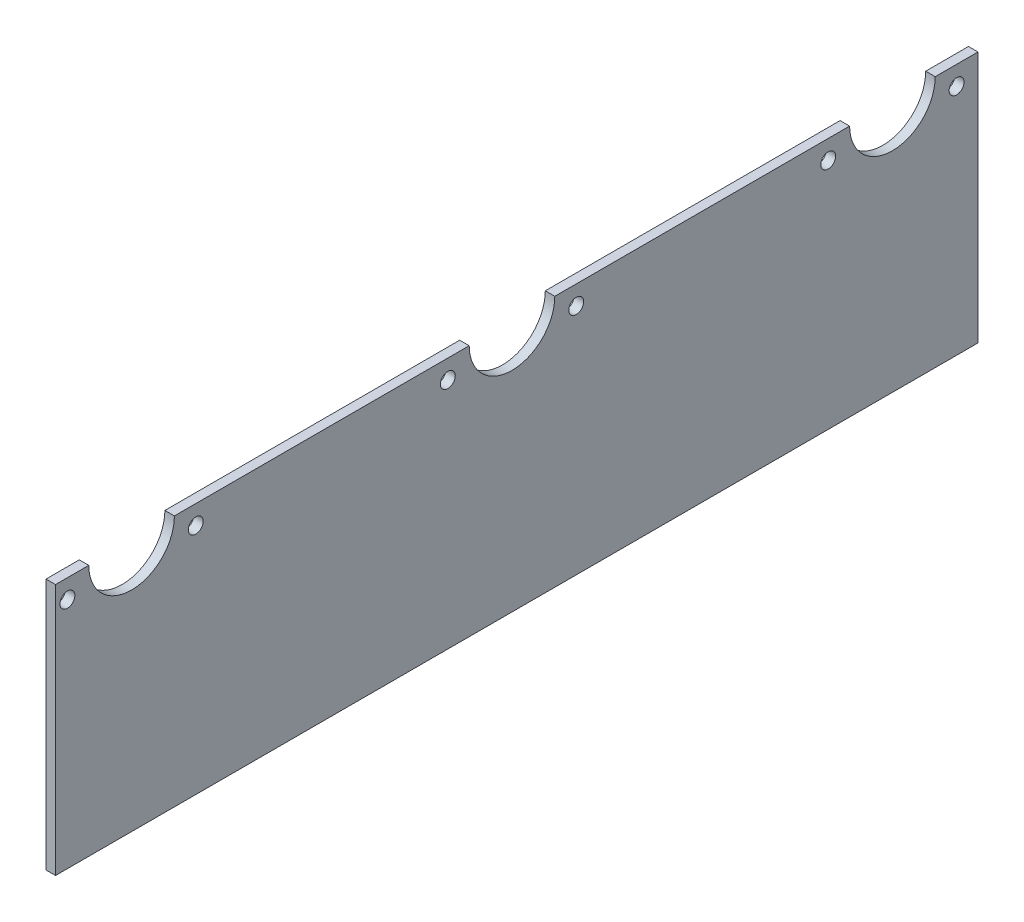
from build123d import *

# Parameters (mm, degrees)
BOSS_EXTRUDE1_DEPTH    = 3.175
F_10_CLEARANCE_HOLE1_D = 4.9784


with BuildPart() as part:
    # Sketch1 → Boss-Extrude1 (new body)
    with BuildSketch(Plane(origin=(0, 0, 0), x_dir=(0, 0, -1), z_dir=(1, 0, 0))):
        with BuildLine():
            Line((153.9875, 0), (-153.9875, 0))
            Line((-153.9875, 0), (-153.9875, 84.1375))
            Line((-153.9875, 84.1375), (-142.875, 84.1375))
            ThreePointArc((-142.875, 84.1375), (-128.5875, 69.85), (-114.3, 84.1375))
            Line((-114.3, 84.1375), (-15.875, 84.1375))
            ThreePointArc((-15.875, 84.1375), (-1.5875, 69.85), (12.7, 84.1375))
            Line((12.7, 84.1375), (111.125, 84.1375))
            ThreePointArc((111.125, 84.1375), (125.4125, 69.85), (139.7, 84.1375))
            Line((139.7, 84.1375), (153.9875, 84.1375))
            Line((153.9875, 84.1375), (153.9875, 0))
        make_face()
    extrude(amount=BOSS_EXTRUDE1_DEPTH)

    # #10 Clearance Hole1 (through all)
    with Locations(Plane(origin=(3.175, 0, 0), x_dir=(0, 0, -1), z_dir=(1, 0, 0))):
        with Locations((-150.01875, 77.7875), (-107.15625, 77.7875), (-23.01875, 77.7875), (19.84375, 77.7875), (103.98125, 77.7875), (146.84375, 77.7875)):
            Hole(F_10_CLEARANCE_HOLE1_D / 2)


solid = part.part
